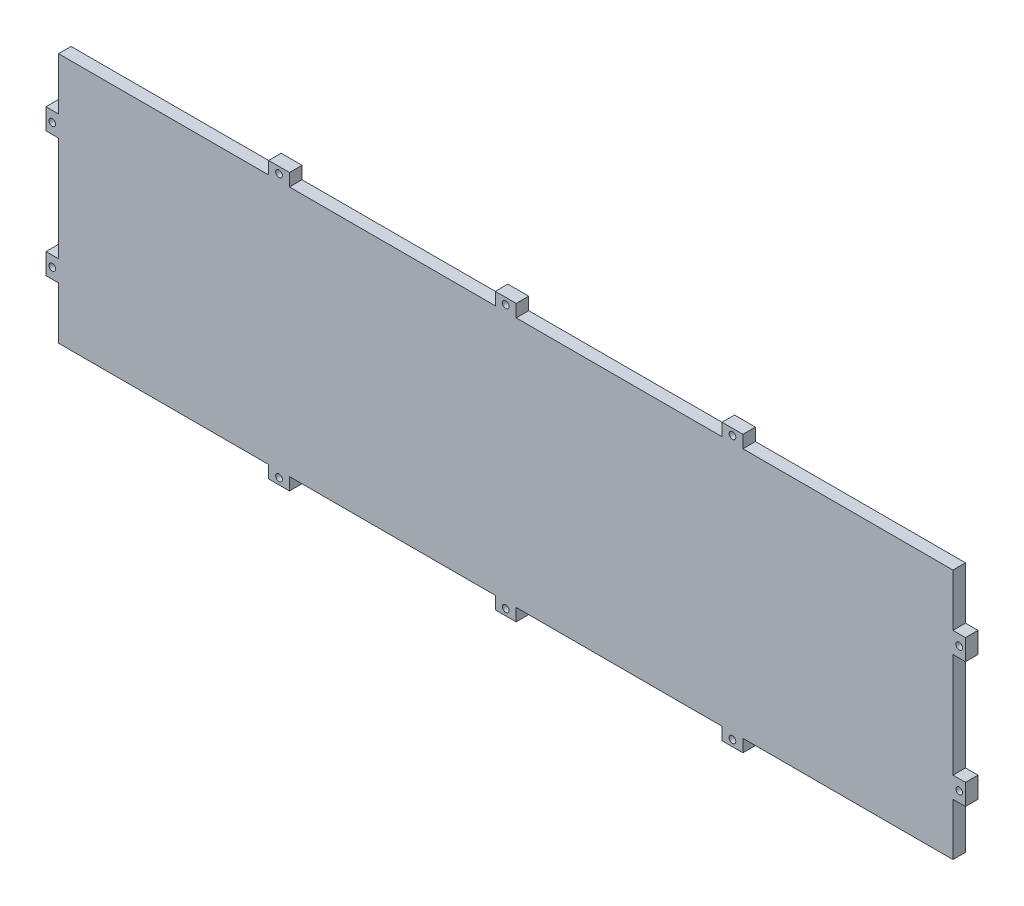
from build123d import *

# Parameters (mm, degrees)
SKETCH1_R           = 1.6
BOSS_EXTRUDE1_DEPTH = 6


with BuildPart() as part:
    # Sketch1 → Boss-Extrude1 (new body)
    with BuildSketch(Plane.XY):
        Polygon((6, 250), (106.5, 250), (106.5, 256), (116.5, 256), (116.5, 250), (215, 250), (215, 256), (225, 256), (225, 250), (323.5, 250), (323.5, 256), (333.5, 256), (333.5, 250), (434, 250), (434, 225), (440, 225), (440, 215), (434, 215), (434, 165), (440, 165), (440, 155), (434, 155), (434, 130), (333.5, 130), (333.5, 124), (323.5, 124), (323.5, 130), (225, 130), (225, 124), (215, 124), (215, 130), (116.5, 130), (116.5, 124), (106.5, 124), (106.5, 130), (6, 130), (6, 155), (0, 155), (0, 165), (6, 165), (6, 215), (0, 215), (0, 225), (6, 225), align=None)
        with Locations((111.5, 127)):
            Circle(SKETCH1_R, mode=Mode.SUBTRACT)
        with Locations((220, 127)):
            Circle(SKETCH1_R, mode=Mode.SUBTRACT)
        with Locations((328.5, 127)):
            Circle(SKETCH1_R, mode=Mode.SUBTRACT)
        with Locations((328.5, 253)):
            Circle(SKETCH1_R, mode=Mode.SUBTRACT)
        with Locations((220, 253)):
            Circle(SKETCH1_R, mode=Mode.SUBTRACT)
        with Locations((111.5, 253)):
            Circle(SKETCH1_R, mode=Mode.SUBTRACT)
        with Locations((3, 220)):
            Circle(SKETCH1_R, mode=Mode.SUBTRACT)
        with Locations((3, 160)):
            Circle(SKETCH1_R, mode=Mode.SUBTRACT)
        with Locations((437, 220)):
            Circle(SKETCH1_R, mode=Mode.SUBTRACT)
        with Locations((437, 160)):
            Circle(SKETCH1_R, mode=Mode.SUBTRACT)
    extrude(amount=-BOSS_EXTRUDE1_DEPTH)


solid = part.part
